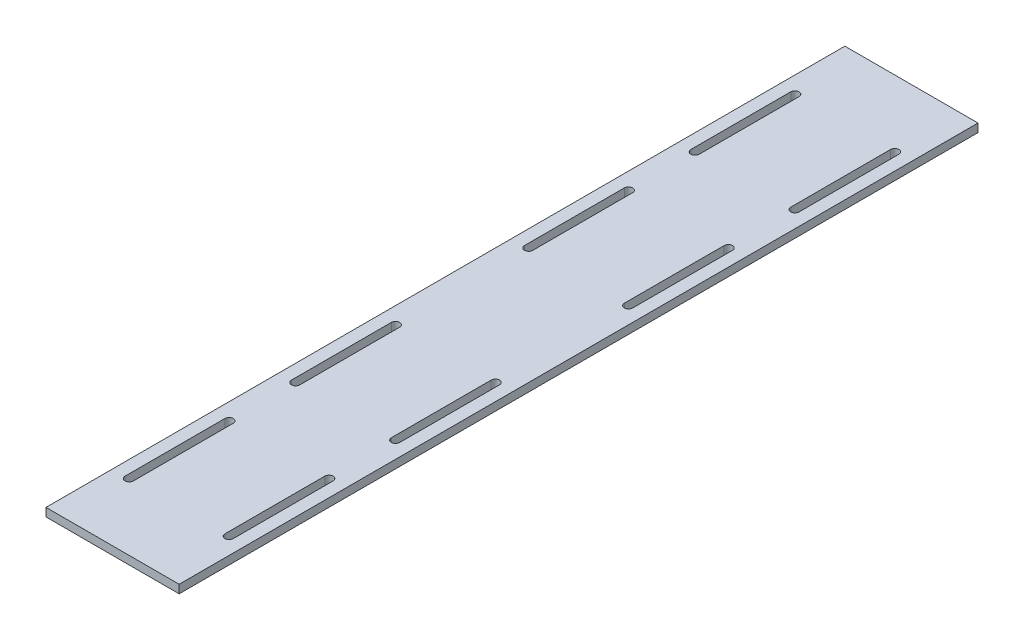
from build123d import *

# Parameters (mm, degrees)
SKETCH1_W            = 101.6
SKETCH1_H            = 609.6
BOSS_EXTRUDE1_DEPTH  = 3.175
CUT_EXTRUDE1_DEPTH   = 310.0695755
MIRROR2_COPY_1_DEPTH = 310.0695755
MIRROR2_COPY_2_DEPTH = 310.0695755


with BuildPart() as part:
    # Sketch1 → Boss-Extrude1 (new, symmetric)
    with BuildSketch(Plane(origin=(0, 0, 0), x_dir=(1, 0, 0), z_dir=(0, 1, 0))):
        Rectangle(SKETCH1_W, SKETCH1_H)
    extrude(amount=BOSS_EXTRUDE1_DEPTH, both=True)

    # Sketch2 → Cut-Extrude1 (cut, through all)
    with BuildSketch(Plane(origin=(0, 3.175, 0), x_dir=(1, 0, 0), z_dir=(0, 1, 0))):
        with BuildLine():
            Line((-34.925, -50.8), (-34.925, -127))
            ThreePointArc((-34.925, -127), (-38.1, -130.175), (-41.275, -127))
            Line((-41.275, -127), (-41.275, -50.8))
            ThreePointArc((-41.275, -50.8), (-38.1, -47.625), (-34.925, -50.8))
        make_face()
        with BuildLine():
            Line((-34.925, -177.8), (-34.925, -254))
            ThreePointArc((-34.925, -254), (-38.1, -257.175), (-41.275, -254))
            Line((-41.275, -254), (-41.275, -177.8))
            ThreePointArc((-41.275, -177.8), (-38.1, -174.625), (-34.925, -177.8))
        make_face()
    cut_extrude1 = extrude(amount=-CUT_EXTRUDE1_DEPTH, mode=Mode.SUBTRACT)

    # Mirror1: Cut-Extrude1 across plane
    add(cut_extrude1.mirror(Plane.XY), mode=Mode.SUBTRACT)

    # Mirror2 copy 1 sketch → Mirror2 copy 1 (cut, through all)
    with BuildSketch(Plane(origin=(0, 3.175, 0), x_dir=(-1, 0, 0), z_dir=(0, 1, 0))):
        with BuildLine():
            Line((-34.925, -50.8), (-34.925, -127))
            ThreePointArc((-34.925, -127), (-38.1, -130.175), (-41.275, -127))
            Line((-41.275, -127), (-41.275, -50.8))
            ThreePointArc((-41.275, -50.8), (-38.1, -47.625), (-34.925, -50.8))
        make_face()
        with BuildLine():
            Line((-34.925, -177.8), (-34.925, -254))
            ThreePointArc((-34.925, -254), (-38.1, -257.175), (-41.275, -254))
            Line((-41.275, -254), (-41.275, -177.8))
            ThreePointArc((-41.275, -177.8), (-38.1, -174.625), (-34.925, -177.8))
        make_face()
    extrude(amount=-MIRROR2_COPY_1_DEPTH, mode=Mode.SUBTRACT)

    # Mirror2 copy 2 sketch → Mirror2 copy 2 (cut, through all)
    with BuildSketch(Plane(origin=(0, 3.175, 0), x_dir=(-1, 0, 0), z_dir=(0, 1, 0))):
        with BuildLine():
            Line((-34.925, 50.8), (-34.925, 127))
            ThreePointArc((-34.925, 127), (-38.1, 130.175), (-41.275, 127))
            Line((-41.275, 127), (-41.275, 50.8))
            ThreePointArc((-41.275, 50.8), (-38.1, 47.625), (-34.925, 50.8))
        make_face()
        with BuildLine():
            Line((-34.925, 177.8), (-34.925, 254))
            ThreePointArc((-34.925, 254), (-38.1, 257.175), (-41.275, 254))
            Line((-41.275, 254), (-41.275, 177.8))
            ThreePointArc((-41.275, 177.8), (-38.1, 174.625), (-34.925, 177.8))
        make_face()
    extrude(amount=-MIRROR2_COPY_2_DEPTH, mode=Mode.SUBTRACT)


solid = part.part
